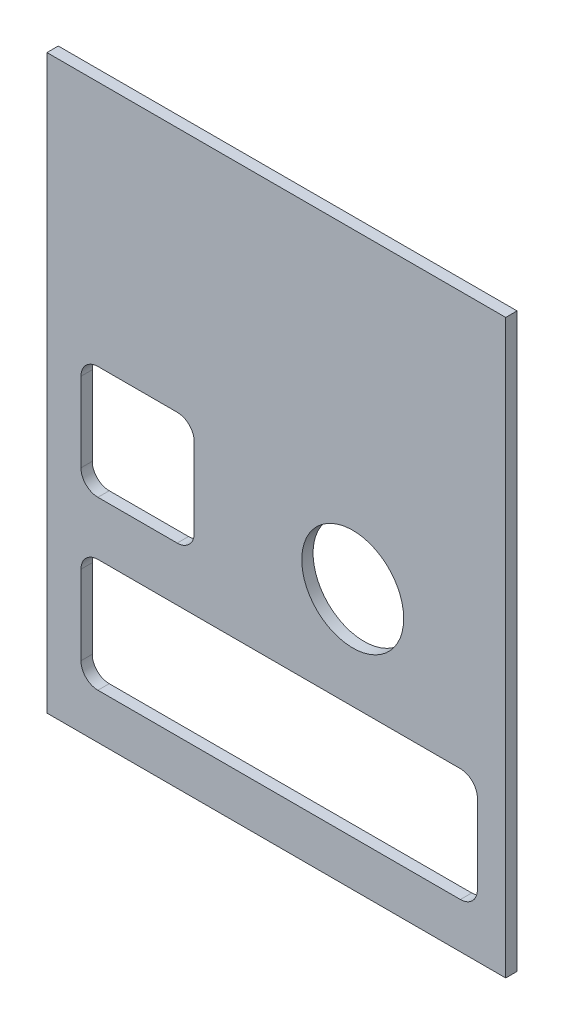
from build123d import *

# Parameters (mm, degrees)
SKETCH1_W           = 81
SKETCH1_H           = 101
BOSS_EXTRUDE1_DEPTH = 2
SKETCH2_R           = 9
CUT_EXTRUDE2_DEPTH  = 2


with BuildPart() as part:
    # Sketch1 → Boss-Extrude1 (new body)
    with BuildSketch(Plane.XY):
        with Locations((-8.394586128, 4.547306085)):
            Rectangle(SKETCH1_W, SKETCH1_H)
    extrude(amount=BOSS_EXTRUDE1_DEPTH)

    # Sketch2 → Cut-Extrude2 (cut)
    with BuildSketch(Plane.XY.offset(2)):
        with Locations((5.091409127, 0)):
            Circle(SKETCH2_R)
        with BuildLine():
            Line((-39.894586128, -17.952693915), (24.105413872, -17.952693915))
            ThreePointArc((24.105413872, -17.952693915), (26.226734215, -18.831373571), (27.105413872, -20.952693915))
            Line((27.105413872, -20.952693915), (27.105413872, -34.952693915))
            ThreePointArc((27.105413872, -34.952693915), (26.226734215, -37.074014258), (24.105413872, -37.952693915))
            Line((24.105413872, -37.952693915), (-39.894586128, -37.952693915))
            ThreePointArc((-39.894586128, -37.952693915), (-42.015906472, -37.074014258), (-42.894586128, -34.952693915))
            Line((-42.894586128, -34.952693915), (-42.894586128, -20.952693915))
            ThreePointArc((-42.894586128, -20.952693915), (-42.015906472, -18.831373571), (-39.894586128, -17.952693915))
        make_face()
        with BuildLine():
            Line((-39.894586128, 11.547306085), (-25.894586128, 11.547306085))
            ThreePointArc((-25.894586128, 11.547306085), (-23.773265785, 10.668626429), (-22.894586128, 8.547306085))
            Line((-22.894586128, 8.547306085), (-22.894586128, -5.452693915))
            ThreePointArc((-22.894586128, -5.452693915), (-23.773265785, -7.574014258), (-25.894586128, -8.452693915))
            Line((-25.894586128, -8.452693915), (-39.894586128, -8.452693915))
            ThreePointArc((-39.894586128, -8.452693915), (-42.015906472, -7.574014258), (-42.894586128, -5.452693915))
            Line((-42.894586128, -5.452693915), (-42.894586128, 8.547306085))
            ThreePointArc((-42.894586128, 8.547306085), (-42.015906472, 10.668626429), (-39.894586128, 11.547306085))
        make_face()
    extrude(amount=-CUT_EXTRUDE2_DEPTH, mode=Mode.SUBTRACT)


solid = part.part
